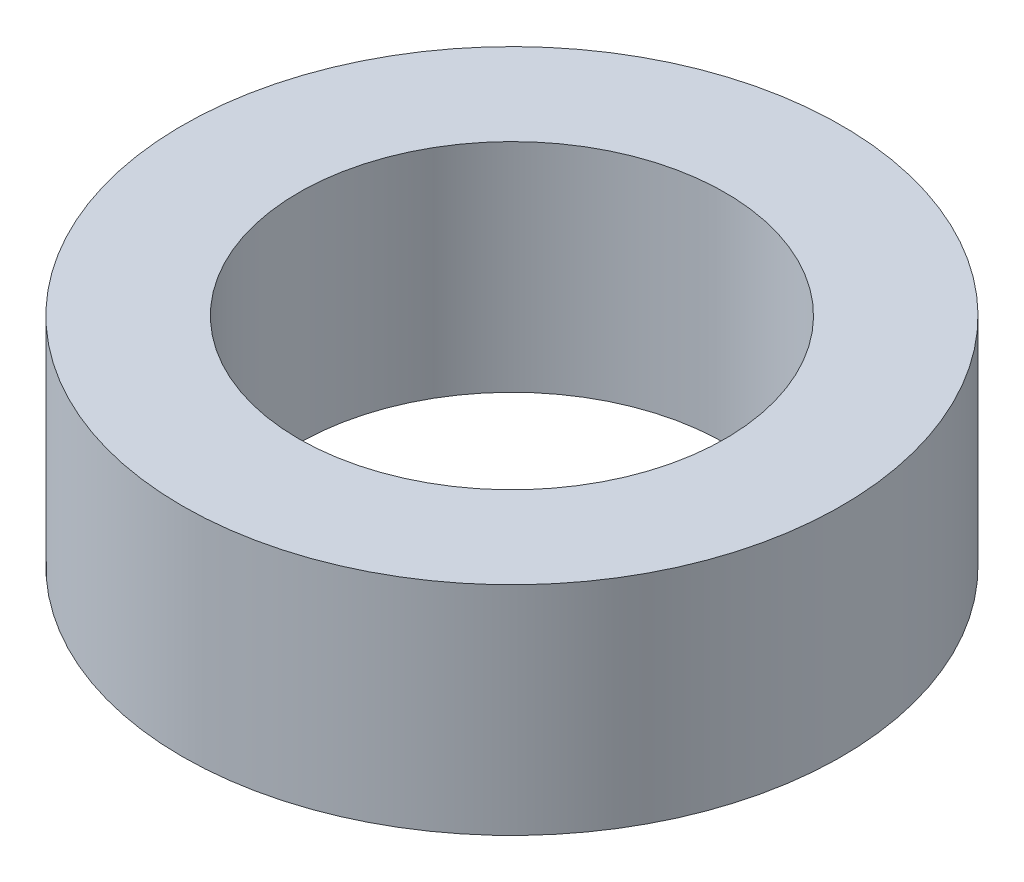
from build123d import *

# Parameters (mm, degrees)
SKETCH1_R           = 42.5
BOSS_EXTRUDE1_DEPTH = 28
SKETCH2_R           = 27.5
CUT_EXTRUDE1_DEPTH  = 67.306108316


with BuildPart() as part:
    # Sketch1 → Boss-Extrude1 (new body)
    with BuildSketch(Plane(origin=(0, 0, 0), x_dir=(1, 0, 0), z_dir=(0, 1, 0))):
        Circle(SKETCH1_R)
    extrude(amount=BOSS_EXTRUDE1_DEPTH)

    # Sketch2 → Cut-Extrude1 (cut, through all)
    with BuildSketch(Plane(origin=(0, 0, 0), x_dir=(1, 0, 0), z_dir=(0, 1, 0))):
        Circle(SKETCH2_R)
    extrude(amount=CUT_EXTRUDE1_DEPTH, mode=Mode.SUBTRACT)


solid = part.part
